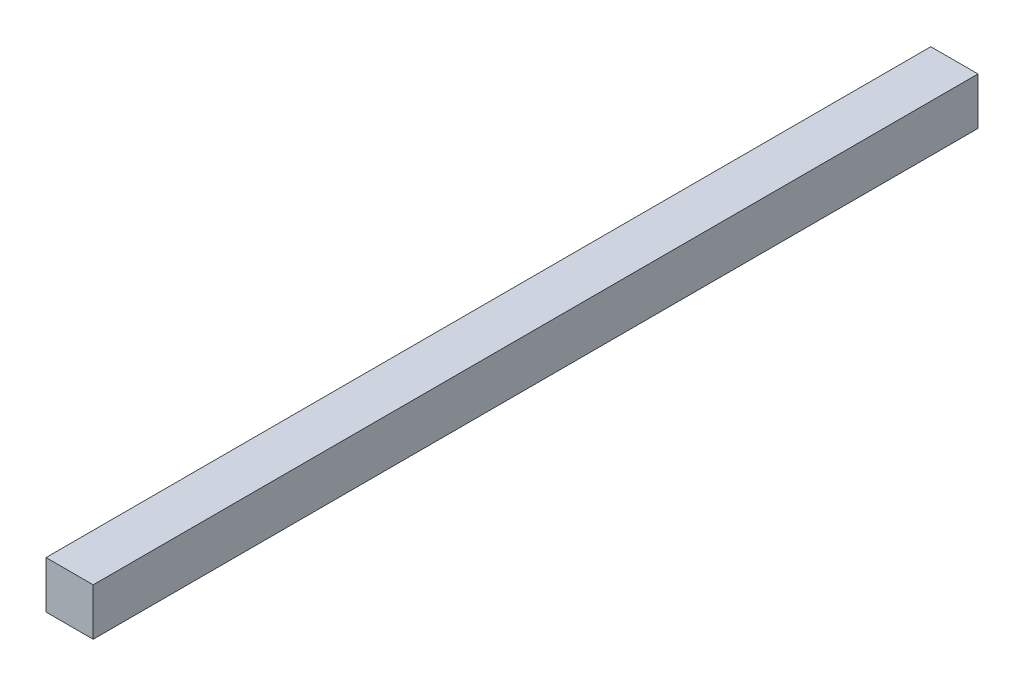
from build123d import *

# Parameters (mm, degrees)
SKETCH1_W           = 50.8
SKETCH1_H           = 50.8
BOSS_EXTRUDE1_DEPTH = 952.5


with BuildPart() as part:
    # Sketch1 → Boss-Extrude1 (new body)
    with BuildSketch(Plane.XY):
        Rectangle(SKETCH1_W, SKETCH1_H)
    extrude(amount=BOSS_EXTRUDE1_DEPTH)


solid = part.part
